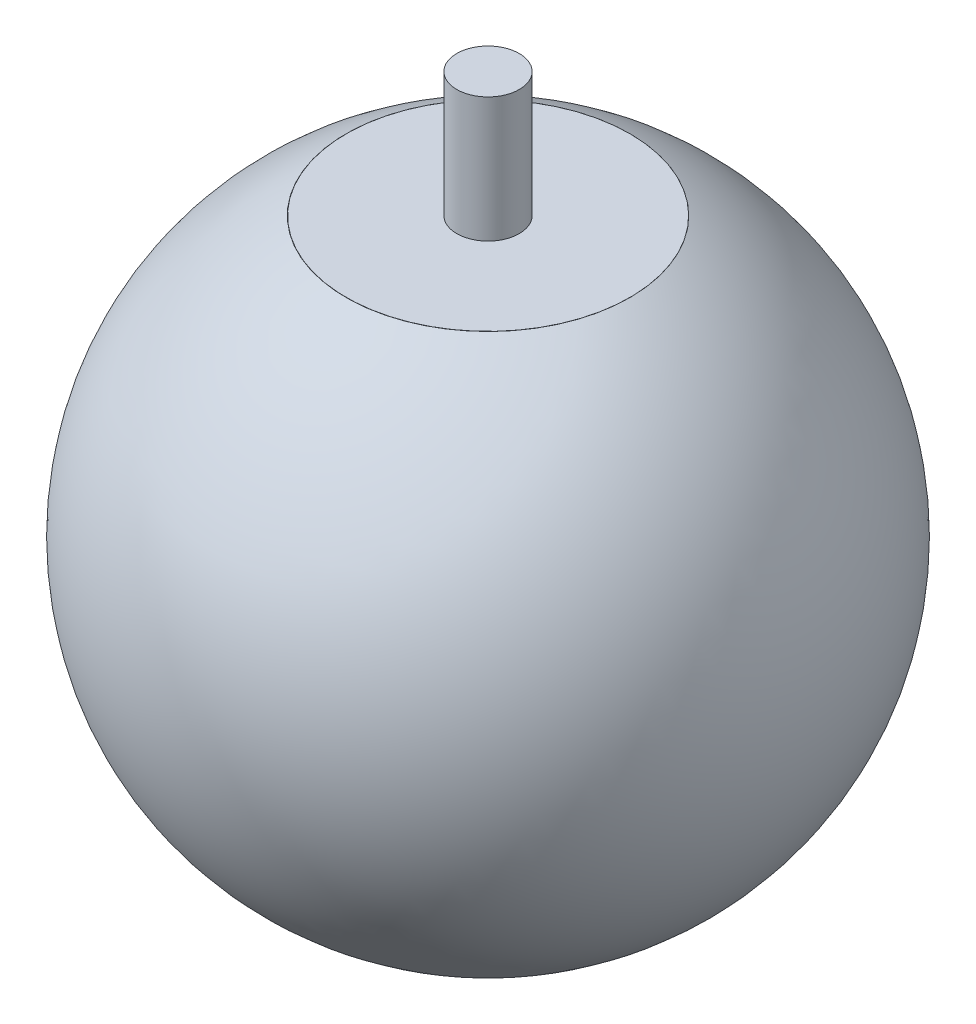
from build123d import *

# Parameters (mm, degrees)
CUT_EXTRUDE_1_DEPTH      = 10
CUT_EXTRUDE_1_DEPTH_BACK = 10
SKETCH_2_R               = 2.273545296
SKETCH_5_W               = 0.5
SKETCH_5_H               = 4
SKETCH_6_W               = 2.271749064
SKETCH_6_H               = 0.112579045


with BuildPart() as part:
    # 草图1 → 旋转2 (revolve)
    with BuildSketch(Plane.XY):
        with BuildLine():
            ThreePointArc((0, -5), (5, 0), (0, 5))
            Line((0, 5), (0, 4.9))
            ThreePointArc((0, 4.9), (4.9, 0), (0, -4.9))
            Line((0, -4.9), (0, -5))
        make_face()
    revolve(axis=Axis((0, 5, 0), (0, -1, 0)))

    # 草图2 → 切除-拉伸1 (cut, two sides: drawn at the far end of the back side and taken through both)
    with BuildSketch(Plane(origin=(0, 0, 0), x_dir=(1, 0, 0), z_dir=(0, 1, 0)).offset(-CUT_EXTRUDE_1_DEPTH_BACK)):
        Circle(SKETCH_2_R)
    extrude(amount=CUT_EXTRUDE_1_DEPTH + CUT_EXTRUDE_1_DEPTH_BACK, mode=Mode.SUBTRACT)


with BuildPart() as body_2:
    # 草图5 → 旋转8 (revolve)
    with BuildSketch(Plane(origin=(0, 0, 0), x_dir=(0, 0, -1), z_dir=(1, 0, 0))):
        with Locations((-0.25, 4.453200174)):
            Rectangle(SKETCH_5_W, SKETCH_5_H)
    revolve(axis=Axis((0, 6.453200174, 0), (0, -1, 0)))

    # 草图6 → 旋转9 (revolve)
    with BuildSketch(Plane(origin=(0, 0, 0), x_dir=(0, 0, -1), z_dir=(1, 0, 0))):
        with Locations((1.137670764, 4.396910652)):
            Rectangle(SKETCH_6_W, SKETCH_6_H)
    revolve(axis=Axis((0, 4.340621129, -0.001796232), (0, 1, 0)))


solid = Compound([part.part, body_2.part])
